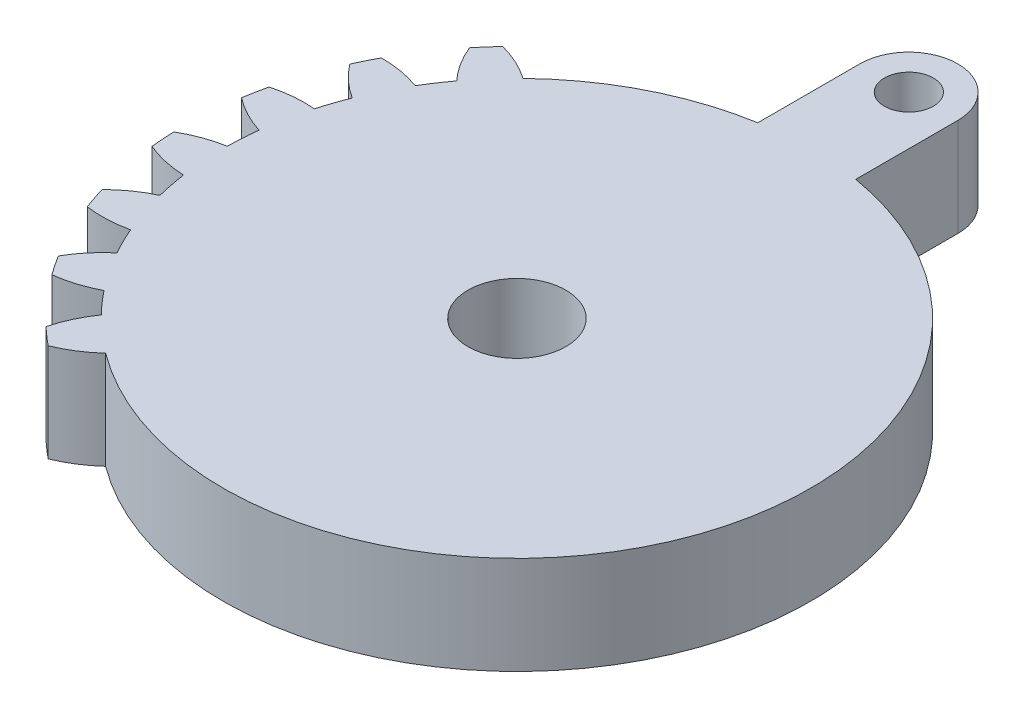
from build123d import *

# Parameters (mm, degrees)
SKETCH1_R           = 19.05
SKETCH1_R_2         = 3.175
BOSS_EXTRUDE1_DEPTH = 6.35
BOSS_EXTRUDE3_DEPTH = 6.35
CIRPATTERN2_DEPTH   = 6.35
SKETCH4_R           = 1.5875
BOSS_EXTRUDE4_DEPTH = 6.35


# Read off the part's stored shape, not the designer's step: CirPattern2
with BuildPart() as part:
    # Sketch1 → Boss-Extrude1 (new body)
    with BuildSketch(Plane(origin=(0, 0, 0), x_dir=(1, 0, 0), z_dir=(0, 1, 0))):
        with Locations(Location((0, 0, 0), (0, 0, 270))):
            Circle(SKETCH1_R)
        with Locations(Location((0, 0, 0), (0, 0, 270))):
            Circle(SKETCH1_R_2, mode=Mode.SUBTRACT)
    extrude(amount=BOSS_EXTRUDE1_DEPTH)

    # Sketch3 → Boss-Extrude3 (add)
    with BuildSketch(Plane(origin=(0, 0, 0), x_dir=(1, 0, 0), z_dir=(0, 1, 0))):
        with BuildLine():
            ThreePointArc((-18.32709122, 5.198098444), (-19.680979383, 5.197152008), (-21.013329851, 4.956618665))
            ThreePointArc((-21.013329851, 4.956618665), (-21.175154204, 4.212000052), (-21.310601203, 3.462134657))
            ThreePointArc((-21.310601203, 3.462134657), (-20.171718001, 2.730042376), (-18.921250622, 2.211057413))
            ThreePointArc((-18.921250622, 2.211057413), (-18.683959592, 3.716470634), (-18.32709122, 5.198098444))
        make_face()
    extrude(amount=BOSS_EXTRUDE3_DEPTH)

    # CirPattern2 outline → CirPattern2 (add)
    with BuildSketch(Plane(origin=(0, 0, 0), x_dir=(1, 0, 0), z_dir=(0, 1, 0))):
        with BuildLine():
            ThreePointArc((-17.704260875, 7.032897477), (-17.085425728, 8.425599549), (-16.357243856, 9.764377784))
            ThreePointArc((-16.357243856, 9.764377784), (-17.665244353, 10.113875638), (-19.014450689, 10.226375946))
            ThreePointArc((-19.014450689, 10.226375946), (-19.36348249, 9.549012822), (-19.688393689, 8.859754733))
            ThreePointArc((-19.688393689, 8.859754733), (-18.777796417, 7.857843228), (-17.704260875, 7.032897477))
        make_face()
        with BuildLine():
            ThreePointArc((-15.280755006, 11.375457202), (-14.322548335, 12.560537779), (-13.272677354, 13.665230916))
            ThreePointArc((-13.272677354, 13.665230916), (-14.445652113, 14.341355358), (-15.719768136, 14.799222606))
            ThreePointArc((-15.719768136, 14.799222606), (-16.232221443, 14.235276148), (-16.724454683, 13.653597166))
            ThreePointArc((-16.724454683, 13.653597166), (-16.104199039, 12.450145051), (-15.280755006, 11.375457202))
        make_face()
        with BuildLine():
            ThreePointArc((-11.375457197, -15.280755), (-12.560537774, -14.322548329), (-13.66523091, -13.272677349))
            ThreePointArc((-13.66523091, -13.272677349), (-14.341355358, -14.445652113), (-14.799222606, -15.719768136))
            ThreePointArc((-14.799222606, -15.719768136), (-14.235276148, -16.232221443), (-13.653597166, -16.724454683))
            ThreePointArc((-13.653597166, -16.724454683), (-12.450145051, -16.104199039), (-11.375457197, -15.280755))
        make_face()
        with BuildLine():
            ThreePointArc((-14.942798311, -11.81589093), (-15.839496111, -10.583612937), (-16.634821136, -9.28359982))
            ThreePointArc((-16.634821136, -9.28359982), (-17.59149541, -10.241612555), (-18.363526703, -11.353809363))
            ThreePointArc((-18.363526703, -11.353809363), (-17.95142893, -11.994761331), (-17.516969515, -12.620771728))
            ThreePointArc((-17.516969515, -12.620771728), (-16.193990063, -12.33312711), (-14.942798311, -11.81589093))
        make_face()
        with BuildLine():
            ThreePointArc((-17.491812414, -7.545793421), (-18.039018964, -6.123421813), (-18.470775793, -4.661860306))
            ThreePointArc((-18.470775793, -4.661860306), (-19.642804121, -5.339624026), (-20.676386801, -6.214107244))
            ThreePointArc((-20.676386801, -6.214107244), (-20.444221496, -6.939878056), (-20.18658934, -7.657004037))
            ThreePointArc((-20.18658934, -7.657004037), (-18.834241415, -7.72157295), (-17.491812414, -7.545793421))
        make_face()
        with BuildLine():
            ThreePointArc((-21.580185309, -0.650923987), (-21.543774153, -1.41205356), (-21.480526461, -2.171424174))
            ThreePointArc((-21.480526461, -2.171424174), (-20.190970338, -2.583806354), (-18.84878841, -2.761462559))
            ThreePointArc((-18.84878841, -2.761462559), (-19.009212486, -1.245929612), (-19.047977604, 0.277577285))
            ThreePointArc((-19.047977604, 0.277577285), (-20.355488193, -0.073748943), (-21.580185309, -0.650923987))
        make_face()
    extrude(amount=CIRPATTERN2_DEPTH)

    # Sketch4 → Boss-Extrude4 (add)
    with BuildSketch(Plane(origin=(0, 6.35, 0), x_dir=(1, 0, 0), z_dir=(0, 1, 0))):
        with BuildLine():
            Line((-3.175, 3.175), (3.175, 3.175))
            Line((3.175, 3.175), (3.175, 25.399999902))
            ThreePointArc((3.175, 25.399999902), (0, 28.575), (-3.175, 25.399999902))
            Line((-3.175, 25.399999902), (-3.175, 3.175))
        make_face()
        with Locations(Location((0, 25.4, 0), (0, 0, 270))):
            Circle(SKETCH4_R, mode=Mode.SUBTRACT)
    extrude(amount=-BOSS_EXTRUDE4_DEPTH)


solid = part.part
